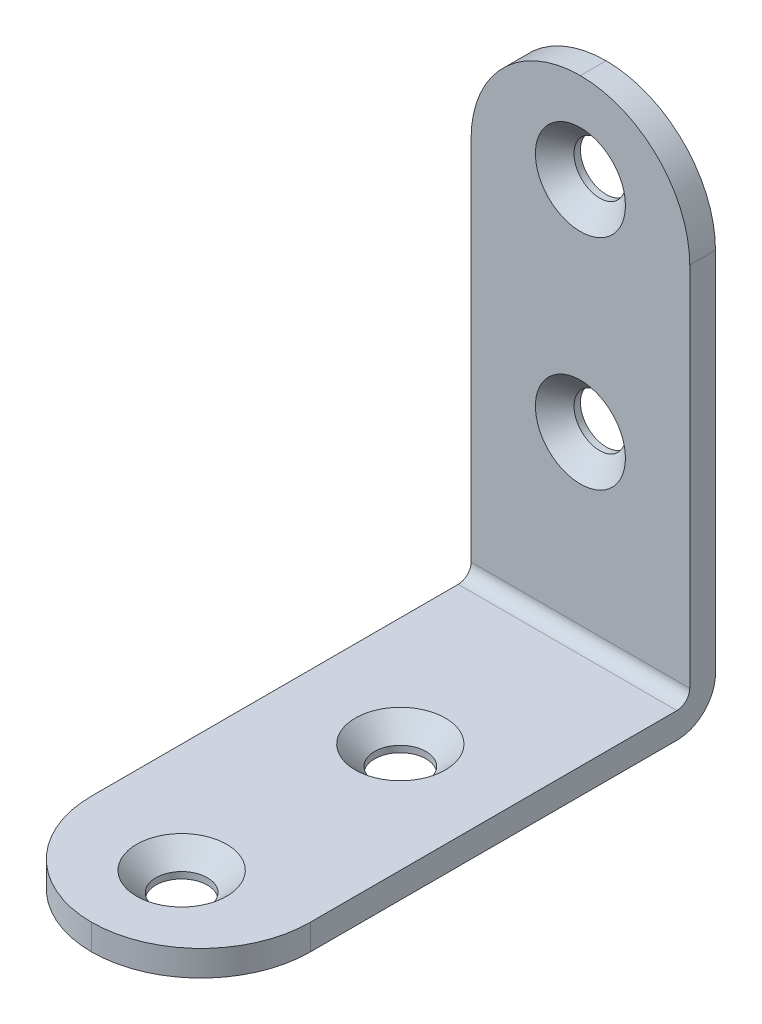
from build123d import *

# Parameters (mm, degrees)
EXTRUDE_1_DEPTH      = 8.5
EXTRUDE_1_DEPTH_BACK = 8.5
SKETCH_3_R           = 2
CUT_EXTRUDE_2_DEPTH  = 15.5
SKETCH_4_R           = 2
CUT_EXTRUDE_3_DEPTH  = 15.5
FILLET_1_R           = 8.5
CHAMFER_1_SIZE       = 1.5


with BuildPart() as part:
    # 草图1 → 凸台-拉伸1 (new, two sides: drawn at the far end of the back side and taken through both)
    with BuildSketch(Plane(origin=(0, 0, 0), x_dir=(0, 0, -1), z_dir=(1, 0, 0)).offset(-EXTRUDE_1_DEPTH_BACK)):
        with BuildLine():
            Line((-40, 0), (-3, 0))
            ThreePointArc((-3, 0), (-0.878679656, 0.878679656), (0, 3))
            Line((0, 3), (0, 40))
            Line((0, 40), (-2, 40))
            Line((-2, 40), (-2, 3))
            ThreePointArc((-2, 3), (-2.292893219, 2.292893219), (-3, 2))
            Line((-3, 2), (-40, 2))
            Line((-40, 2), (-40, 0))
        make_face()
    extrude(amount=EXTRUDE_1_DEPTH + EXTRUDE_1_DEPTH_BACK)

    # 草图3 → 切除-拉伸2 (cut)
    with BuildSketch(Plane(origin=(0, 2, 0), x_dir=(1, 0, 0), z_dir=(0, 1, 0))):
        with Locations(Location((0, -33, 0), (0, 0, 270))):
            Circle(SKETCH_3_R)
        with Locations(Location((0, -16, 0), (0, 0, 270))):
            Circle(SKETCH_3_R)
    extrude(amount=-CUT_EXTRUDE_2_DEPTH, mode=Mode.SUBTRACT)

    # 草图4 → 切除-拉伸3 (cut)
    with BuildSketch(Plane.XY.offset(2)):
        with Locations((0, 33)):
            Circle(SKETCH_4_R)
        with Locations((0, 16)):
            Circle(SKETCH_4_R)
    extrude(amount=-CUT_EXTRUDE_3_DEPTH, mode=Mode.SUBTRACT)

    # 圆角1
    fillet_1_edges = [part.edges().sort_by_distance(p)[0] for p in [
        (8.5, 40, 1),
        (-8.5, 40, 1),
        (8.5, 1, 40),
        (-8.5, 1, 40),
    ]]
    fillet(fillet_1_edges, radius=FILLET_1_R - 0.0001)  # a hair under: the kernel refuses the full size

    # 倒角1
    chamfer_1_edges = [part.edges().sort_by_distance(p)[0] for p in [
        (0, 2, 31),
        (0, 2, 14),
        (-2, 33, 2),
        (-2, 16, 2),
    ]]
    chamfer(chamfer_1_edges, length=CHAMFER_1_SIZE)


solid = part.part
